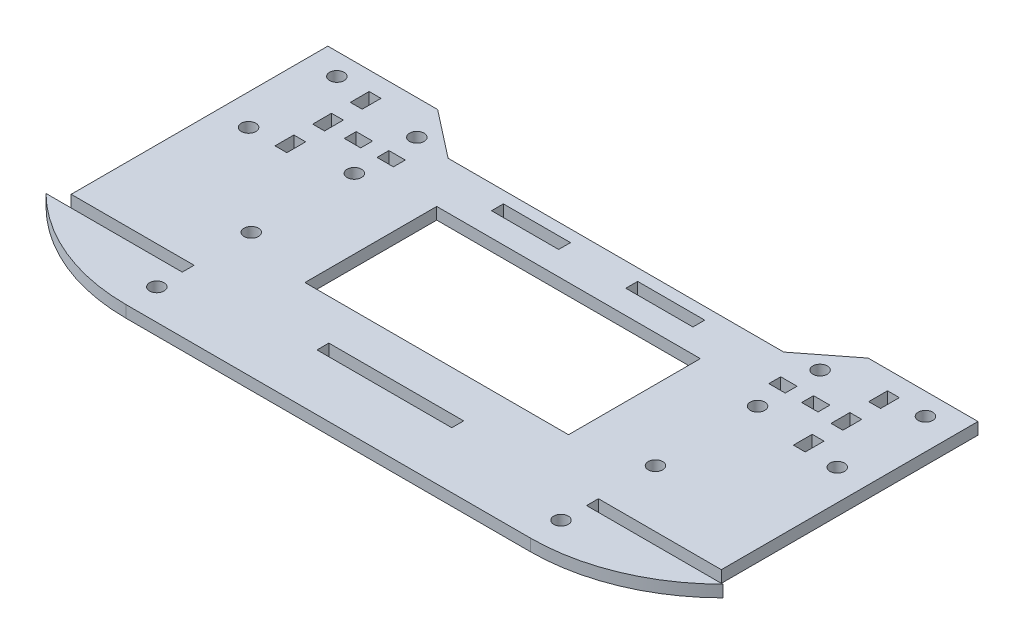
from build123d import *

# Parameters (mm, degrees)
SKETCH1_R           = 1.65
SKETCH1_W           = 30.68
SKETCH1_H           = 2.7
SKETCH1_W_2         = 15.28
SKETCH1_W_3         = 2.7
SKETCH1_H_2         = 4.285714286
SKETCH1_W_4         = 3.73
SKETCH1_W_5         = 60
SKETCH1_H_3         = 30
BOSS_EXTRUDE1_DEPTH = 2.7


with BuildPart() as part:
    # Sketch1 → Boss-Extrude1 (new body)
    with BuildSketch(Plane(origin=(0, 0, 0), x_dir=(1, 0, 0), z_dir=(0, 1, 0))):
        with BuildLine():
            Line((-46, 0), (46, 0))
            ThreePointArc((46, 0), (62.780941571, 3.32568378), (77.025151087, 12.8))
            Line((77.025151087, 12.8), (46.015151087, 12.8))
            Line((46.015151087, 12.8), (46.015151087, 15.5))
            Line((46.015151087, 15.5), (73.995151087, 15.5))
            Line((73.995151087, 15.5), (73.995151087, 35.5))
            Line((73.995151087, 35.5), (73.995151087, 43.92))
            Line((73.995151087, 43.92), (73.995151087, 73.92))
            Line((73.995151087, 73.92), (68.995151087, 73.92))
            Line((68.995151087, 73.92), (48.995151087, 73.92))
            Line((48.995151087, 73.92), (38.2, 65.5))
            Line((38.2, 65.5), (-38.2, 65.5))
            Line((-38.2, 65.5), (-48.995151087, 73.92))
            Line((-48.995151087, 73.92), (-68.995151087, 73.92))
            Line((-68.995151087, 73.92), (-73.995151087, 73.92))
            Line((-73.995151087, 73.92), (-73.995151087, 43.92))
            Line((-73.995151087, 43.92), (-73.995151087, 35.5))
            Line((-73.995151087, 35.5), (-73.995151087, 15.5))
            Line((-73.995151087, 15.5), (-46.015151087, 15.5))
            Line((-46.015151087, 15.5), (-46.015151087, 12.8))
            Line((-46.015151087, 12.8), (-77.025151087, 12.8))
            ThreePointArc((-77.025151087, 12.8), (-62.780941571, 3.32568378), (-46, 0))
        make_face()
        with Locations((46, 28.5)):
            Circle(SKETCH1_R, mode=Mode.SUBTRACT)
        with Locations((46, 7)):
            Circle(SKETCH1_R, mode=Mode.SUBTRACT)
        with Locations((-46, 7)):
            Circle(SKETCH1_R, mode=Mode.SUBTRACT)
        with Locations((-46, 28.5)):
            Circle(SKETCH1_R, mode=Mode.SUBTRACT)
        with Locations((66.995151087, 68.959972417)):
            Circle(SKETCH1_R, mode=Mode.SUBTRACT)
        with Locations((66.995151087, 48.880027583)):
            Circle(SKETCH1_R, mode=Mode.SUBTRACT)
        with Locations((45.892266276, 66.076819007)):
            Circle(SKETCH1_R, mode=Mode.SUBTRACT)
        with Locations((45.892266276, 51.843125828)):
            Circle(SKETCH1_R, mode=Mode.SUBTRACT)
        with Locations((-66.995151087, 48.880027583)):
            Circle(SKETCH1_R, mode=Mode.SUBTRACT)
        with Locations((-45.892266276, 66.076819007)):
            Circle(SKETCH1_R, mode=Mode.SUBTRACT)
        with Locations((-66.995151087, 68.959972417)):
            Circle(SKETCH1_R, mode=Mode.SUBTRACT)
        with Locations((-45.892266276, 51.843125828)):
            Circle(SKETCH1_R, mode=Mode.SUBTRACT)
        with Locations((0, 14.15)):
            Rectangle(SKETCH1_W, SKETCH1_H, mode=Mode.SUBTRACT)
        with Locations((-15.28, 61.45)):
            Rectangle(SKETCH1_W_2, SKETCH1_H, mode=Mode.SUBTRACT)
        with Locations((15.28, 61.45)):
            Rectangle(SKETCH1_W_2, SKETCH1_H, mode=Mode.SUBTRACT)
        with Locations((58.995151087, 58.959972417)):
            Rectangle(SKETCH1_W_3, SKETCH1_H_2, mode=Mode.SUBTRACT)
        with Locations((44.590151087, 58.927994483)):
            Rectangle(SKETCH1_W_4, SKETCH1_H, mode=Mode.SUBTRACT)
        with Locations((58.995151087, 50.388543846)):
            Rectangle(SKETCH1_W_3, SKETCH1_H_2, mode=Mode.SUBTRACT)
        with Locations((58.995151087, 67.531400989)):
            Rectangle(SKETCH1_W_3, SKETCH1_H_2, mode=Mode.SUBTRACT)
        with Locations((52.050151087, 58.94398345)):
            Rectangle(SKETCH1_W_4, SKETCH1_H, mode=Mode.SUBTRACT)
        with Locations((-52.050151087, 58.94398345)):
            Rectangle(SKETCH1_W_4, SKETCH1_H, mode=Mode.SUBTRACT)
        with Locations((-44.590151087, 58.927994483)):
            Rectangle(SKETCH1_W_4, SKETCH1_H, mode=Mode.SUBTRACT)
        with Locations((-58.995151087, 67.531400989)):
            Rectangle(SKETCH1_W_3, SKETCH1_H_2, mode=Mode.SUBTRACT)
        with Locations((-58.995151087, 58.959972417)):
            Rectangle(SKETCH1_W_3, SKETCH1_H_2, mode=Mode.SUBTRACT)
        with Locations((-58.995151087, 50.388543846)):
            Rectangle(SKETCH1_W_3, SKETCH1_H_2, mode=Mode.SUBTRACT)
        with Locations((0, 39.71)):
            Rectangle(SKETCH1_W_5, SKETCH1_H_3, mode=Mode.SUBTRACT)
    extrude(amount=BOSS_EXTRUDE1_DEPTH)


solid = part.part
